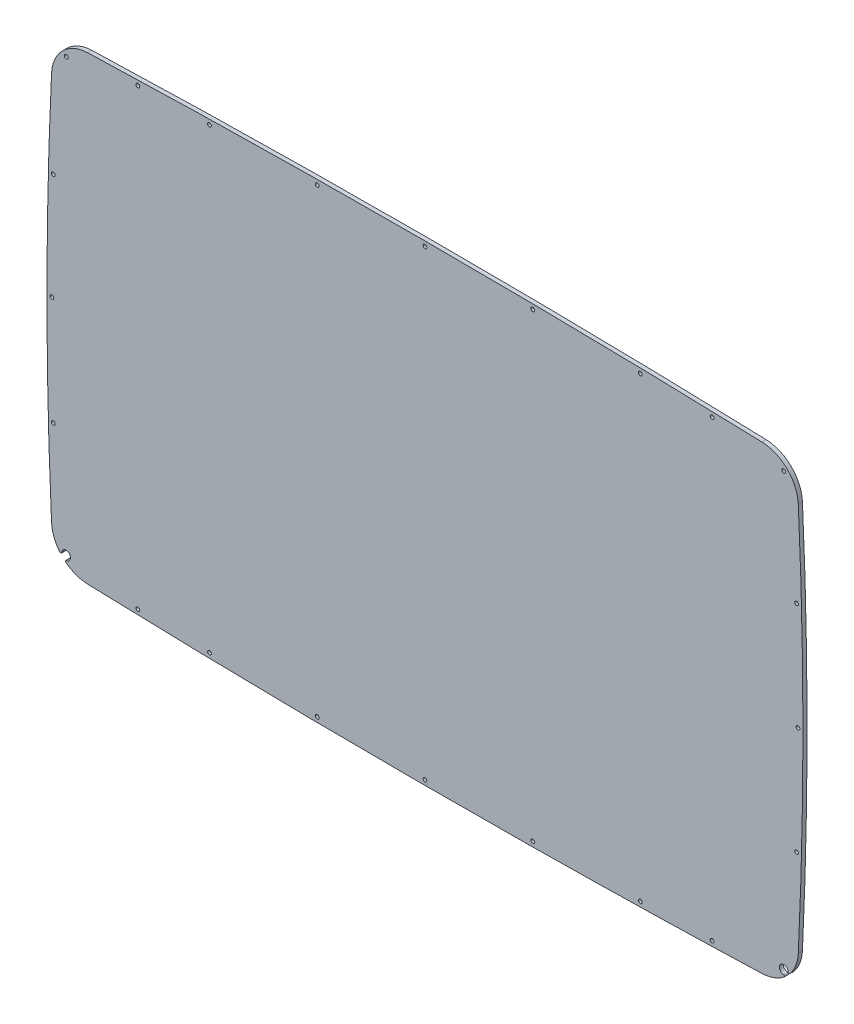
from build123d import *

# Parameters (mm, degrees)
SKETCH1_R           = 1.4351
BOSS_EXTRUDE1_DEPTH = 3.175


with BuildPart() as part:
    # Sketch1 → Boss-Extrude1 (new body)
    with BuildSketch(Plane.XY):
        with BuildLine():
            ThreePointArc((2.968751211, -181.189695026), (41.295889155, -181.079537948), (79.6220041, -180.778621425))
            Line((79.6220041, -180.778621425), (85.559165015, -180.714940362))
            ThreePointArc((85.559165015, -180.714940362), (123.887667874, -180.193645916), (162.213100977, -179.481566675))
            ThreePointArc((162.213100977, -179.481566675), (165.18118139, -179.418457741), (168.149237253, -179.35420455))
            ThreePointArc((168.149237253, -179.35420455), (192.659124698, -178.779845314), (217.167059321, -178.127456184))
            ThreePointArc((217.167059321, -178.127456184), (220.135246662, -178.043143258), (223.103401271, -177.957685792))
            Line((223.103401271, -177.957685792), (258.423629847, -176.852835003))
            ThreePointArc((258.423629847, -176.852835003), (267.290868319, -175.133004675), (275.18450496, -170.742533734))
            ThreePointArc((275.18450496, -170.742533734), (275.463497332, -169.849730119), (274.729768057, -169.269578078))
            ThreePointArc((274.729768057, -169.269578078), (273.124193217, -168.736074582), (271.981091739, -167.488751226))
            ThreePointArc((271.981091739, -167.488751226), (272.591341013, -163.514960035), (276.573397857, -162.961205675))
            ThreePointArc((276.573397857, -162.961205675), (277.804361793, -164.121905608), (278.315010087, -165.734895027))
            ThreePointArc((278.315010087, -165.734895027), (278.884683644, -166.476789277), (279.781359306, -166.210504095))
            ThreePointArc((279.781359306, -166.210504095), (284.283709644, -158.379432473), (286.129131597, -149.53685032))
            ThreePointArc((286.129131597, -149.53685032), (287.482131945, -117.828809116), (288.512976487, -86.108660213))
            ThreePointArc((288.512976487, -86.108660213), (288.592974065, -83.139049998), (288.670148028, -80.169365063))
            ThreePointArc((288.670148028, -80.169365063), (289.416235277, -41.572865854), (289.685382101, -2.970094485))
            ThreePointArc((289.685382101, -2.970094485), (289.686328933, 0.0005929), (289.684451162, 2.971279842))
            ThreePointArc((289.684451162, 2.971279842), (289.409759592, 41.084465923), (288.670148028, 79.191465063))
            ThreePointArc((288.670148028, 79.191465063), (288.592974065, 82.161149998), (288.512976487, 85.130760213))
            ThreePointArc((288.512976487, 85.130760213), (287.482131945, 116.850909116), (286.129131597, 148.55895032))
            ThreePointArc((286.129131597, 148.55895032), (284.283709644, 157.401532473), (279.781359306, 165.232604095))
            ThreePointArc((279.781359306, 165.232604095), (277.610750544, 167.6282656), (275.18450496, 169.764633734))
            ThreePointArc((275.18450496, 169.764633734), (267.290868319, 174.155104675), (258.423629847, 175.874935003))
            ThreePointArc((258.423629847, 175.874935003), (240.76414932, 176.447620699), (223.103401271, 176.979785792))
            ThreePointArc((223.103401271, 176.979785792), (220.135246662, 177.065243258), (217.167059321, 177.149556184))
            ThreePointArc((217.167059321, 177.149556184), (192.659124698, 177.801945314), (168.149237253, 178.37630455))
            ThreePointArc((168.149237253, 178.37630455), (165.18118139, 178.440557741), (162.213100977, 178.503666675))
            ThreePointArc((162.213100977, 178.503666675), (123.887667874, 179.215745916), (85.559165015, 179.737040362))
            ThreePointArc((85.559165015, 179.737040362), (82.590590695, 179.769453121), (79.6220041, 179.800721425))
            ThreePointArc((79.6220041, 179.800721425), (41.295889155, 180.101637948), (2.968751211, 180.211795026))
            ThreePointArc((2.968751211, 180.211795026), (0, 180.212367286), (-2.968751211, 180.211795026))
            ThreePointArc((-2.968751211, 180.211795026), (-41.295889155, 180.101637948), (-79.6220041, 179.800721425))
            ThreePointArc((-79.6220041, 179.800721425), (-82.590590695, 179.769453121), (-85.559165015, 179.737040362))
            ThreePointArc((-85.559165015, 179.737040362), (-123.887667874, 179.215745916), (-162.213100977, 178.503666675))
            ThreePointArc((-162.213100977, 178.503666675), (-165.18118139, 178.440557741), (-168.149237253, 178.37630455))
            ThreePointArc((-168.149237253, 178.37630455), (-192.659124698, 177.801945314), (-217.167059321, 177.149556184))
            ThreePointArc((-217.167059321, 177.149556184), (-220.135246662, 177.065243258), (-223.103401271, 176.979785792))
            ThreePointArc((-223.103401271, 176.979785792), (-240.76414932, 176.447620699), (-258.423629847, 175.874935003))
            ThreePointArc((-258.423629847, 175.874935003), (-267.290868319, 174.155104675), (-275.18450496, 169.764633734))
            ThreePointArc((-275.18450496, 169.764633734), (-277.610750544, 167.6282656), (-279.781359306, 165.232604095))
            ThreePointArc((-279.781359306, 165.232604095), (-284.283709644, 157.401532473), (-286.129131597, 148.55895032))
            ThreePointArc((-286.129131597, 148.55895032), (-287.482131945, 116.850909116), (-288.512976487, 85.130760213))
            ThreePointArc((-288.512976487, 85.130760213), (-288.592974065, 82.161149998), (-288.670148028, 79.191465063))
            ThreePointArc((-288.670148028, 79.191465063), (-289.409759592, 41.084465923), (-289.684451162, 2.971279842))
            ThreePointArc((-289.684451162, 2.971279842), (-289.686328933, 0.0005929), (-289.685382101, -2.970094485))
            ThreePointArc((-289.685382101, -2.970094485), (-289.416235277, -41.572865854), (-288.670148028, -80.169365063))
            ThreePointArc((-288.670148028, -80.169365063), (-288.592974065, -83.139049998), (-288.512976487, -86.108660213))
            ThreePointArc((-288.512976487, -86.108660213), (-287.482131945, -117.828809116), (-286.129131597, -149.53685032))
            ThreePointArc((-286.129131597, -149.53685032), (-284.283709644, -158.379432473), (-279.781359306, -166.210504095))
            ThreePointArc((-279.781359306, -166.210504095), (-278.884683644, -166.476789277), (-278.315010087, -165.734895027))
            ThreePointArc((-278.315010087, -165.734895027), (-277.804361793, -164.121905608), (-276.573397857, -162.961205675))
            ThreePointArc((-276.573397857, -162.961205675), (-272.591341013, -163.514960035), (-271.981091739, -167.488751226))
            ThreePointArc((-271.981091739, -167.488751226), (-273.124193217, -168.736074582), (-274.729768057, -169.269578078))
            ThreePointArc((-274.729768057, -169.269578078), (-275.463497332, -169.849730119), (-275.18450496, -170.742533734))
            ThreePointArc((-275.18450496, -170.742533734), (-267.290868319, -175.133004675), (-258.423629847, -176.852835003))
            ThreePointArc((-258.423629847, -176.852835003), (-240.76414932, -177.425520699), (-223.103401271, -177.957685792))
            ThreePointArc((-223.103401271, -177.957685792), (-220.135246662, -178.043143258), (-217.167059321, -178.127456184))
            ThreePointArc((-217.167059321, -178.127456184), (-192.659124698, -178.779845314), (-168.149237253, -179.35420455))
            ThreePointArc((-168.149237253, -179.35420455), (-165.18118139, -179.418457741), (-162.213100977, -179.481566675))
            ThreePointArc((-162.213100977, -179.481566675), (-123.887667874, -180.193645916), (-85.559165015, -180.714940362))
            ThreePointArc((-85.559165015, -180.714940362), (-82.590590695, -180.747353121), (-79.6220041, -180.778621425))
            ThreePointArc((-79.6220041, -180.778621425), (-41.295889155, -181.079537948), (-2.968751211, -181.189695026))
            ThreePointArc((-2.968751211, -181.189695026), (0, -181.190267286), (2.968751211, -181.189695026))
        make_face()
        with Locations((-220.027075225, -174.260724966)):
            Circle(SKETCH1_R, mode=Mode.SUBTRACT)
        with Locations((-165.1, -175.63472853)):
            Circle(SKETCH1_R, mode=Mode.SUBTRACT)
        with Locations((-82.55, -176.962970799)):
            Circle(SKETCH1_R, mode=Mode.SUBTRACT)
        with Locations((0, -177.405667286)):
            Circle(SKETCH1_R, mode=Mode.SUBTRACT)
        with Locations((-284.81033356, -83.03895)):
            Circle(SKETCH1_R, mode=Mode.SUBTRACT)
        with Locations((82.55, -176.962970799)):
            Circle(SKETCH1_R, mode=Mode.SUBTRACT)
        with Locations((165.1, -175.63472853)):
            Circle(SKETCH1_R, mode=Mode.SUBTRACT)
        with Locations((220.027075225, -174.260724966)):
            Circle(SKETCH1_R, mode=Mode.SUBTRACT)
        with Locations((284.81033356, -83.03895)):
            Circle(SKETCH1_R, mode=Mode.SUBTRACT)
        with Locations((-285.902364234, 0)):
            Circle(SKETCH1_R, mode=Mode.SUBTRACT)
        with Locations((-284.81033356, 82.06105)):
            Circle(SKETCH1_R, mode=Mode.SUBTRACT)
        with Locations((-274.954150451, 164.933666346)):
            Circle(SKETCH1_R, mode=Mode.SUBTRACT)
        with Locations((-220.027075225, 173.282824966)):
            Circle(SKETCH1_R, mode=Mode.SUBTRACT)
        with Locations((-165.1, 174.65682853)):
            Circle(SKETCH1_R, mode=Mode.SUBTRACT)
        with Locations((-82.55, 175.985070799)):
            Circle(SKETCH1_R, mode=Mode.SUBTRACT)
        with Locations((0, 176.427767286)):
            Circle(SKETCH1_R, mode=Mode.SUBTRACT)
        with Locations((285.902364234, 0)):
            Circle(SKETCH1_R, mode=Mode.SUBTRACT)
        with Locations((284.81033356, 82.06105)):
            Circle(SKETCH1_R, mode=Mode.SUBTRACT)
        with Locations((82.55, 175.985070799)):
            Circle(SKETCH1_R, mode=Mode.SUBTRACT)
        with Locations((165.1, 174.65682853)):
            Circle(SKETCH1_R, mode=Mode.SUBTRACT)
        with Locations((220.027075225, 173.282824966)):
            Circle(SKETCH1_R, mode=Mode.SUBTRACT)
        with Locations((274.954150451, 164.933666346)):
            Circle(SKETCH1_R, mode=Mode.SUBTRACT)
    extrude(amount=BOSS_EXTRUDE1_DEPTH)


solid = part.part
